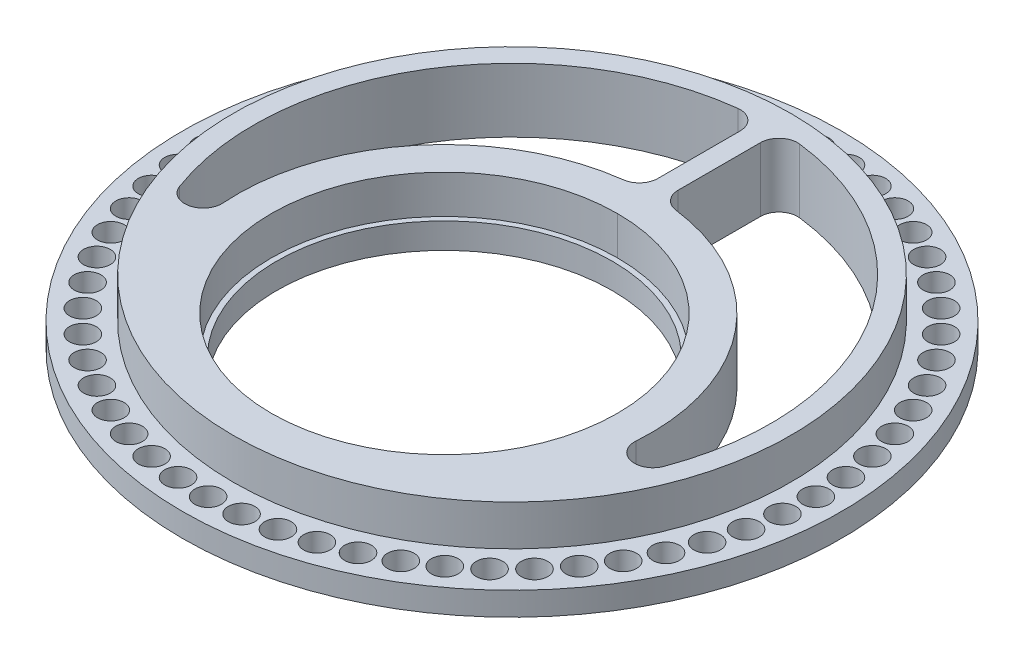
from build123d import *

# Parameters (mm, degrees)
SLOTTED_BODY_EXTRUDE_DEPTH      = 4.191
SLOTTED_BODY_EXTRUDE_DEPTH_BACK = 0.2032
SKETCH1_R                       = 64.4525
SKETCH1_R_2                     = 30.988
SKETCH5_R                       = 52.3875
BOSS_EXTRUDE3_DEPTH             = 7.62
SKETCH6_R                       = 32.512
CUT_EXTRUDE5_DEPTH              = 92.937971014
SKETCH8_R                       = 32.512
SKETCH8_R_2                     = 31.496
BOSS_EXTRUDE4_DEPTH             = 4.795000062
CUT_EXTRUDE6_DEPTH              = 92.937971014
MOVE_START                      = -0.2032
MOVE_FACE1_OUTLINE_R            = 64.4525
MOVE_FACE1_OUTLINE_R_2          = 61.9125
MOVE_FACE1_DEPTH                = 4.3942
SKETCH18_R                      = 2.5
CUT_EXTRUDE7_DEPTH              = 88.888450393
CIRPATTERN1_COUNT               = 60


# Read off the part's stored shape, not the designer's step: Move Face1
with BuildPart() as part:
    # Sketch1 → Slotted-Body Extrude (new, two sides: drawn at the far end of the back side and taken through both)
    with BuildSketch(Plane(origin=(0, 0, 0), x_dir=(1, 0, 0), z_dir=(0, 1, 0)).offset(-SLOTTED_BODY_EXTRUDE_DEPTH_BACK)):
        with Locations(Location((0, 0, 0), (0, 0, 270))):
            Circle(SKETCH1_R)
        with Locations(Location((0, -12.7, 0), (0, 0, 270))):
            Circle(SKETCH1_R_2, mode=Mode.SUBTRACT)
    extrude(amount=SLOTTED_BODY_EXTRUDE_DEPTH + SLOTTED_BODY_EXTRUDE_DEPTH_BACK)

    # Sketch5 → Boss-Extrude3 (add)
    with BuildSketch(Plane(origin=(0, 4.191, 0), x_dir=(1, 0, 0), z_dir=(0, 1, 0))):
        with Locations(Location((0, 0, 0), (0, 0, 90))):
            Circle(SKETCH5_R)
    extrude(amount=BOSS_EXTRUDE3_DEPTH)

    # Sketch6 → Cut-Extrude5 (cut, through all)
    with BuildSketch(Plane.XZ.offset(0.2032)):
        with Locations(Location((0, 12.7, 0), (0, 0, 270))):
            Circle(SKETCH6_R)
    extrude(amount=-CUT_EXTRUDE5_DEPTH, mode=Mode.SUBTRACT)

    # Sketch16 → Cut-Extrude6 (cut, through all)
    with BuildSketch(Plane(origin=(0, 11.811, 0), x_dir=(1, 0, 0), z_dir=(0, 1, 0))):
        with BuildLine():
            Line((1.905, 44.760744171), (1.905, 29.30917357))
            ThreePointArc((1.905, 29.30917357), (2.775290296, 27.00232019), (4.952428786, 25.845148763))
            ThreePointArc((4.952428786, 25.845148763), (30.083852846, 11.901155297), (38.761124089, -15.498267924))
            ThreePointArc((38.761124089, -15.498267924), (41.501270881, -19.162235056), (45.517024238, -16.969797016))
            ThreePointArc((45.517024238, -16.969797016), (41.490387768, 25.265019871), (5.815616197, 48.228125762))
            ThreePointArc((5.815616197, 48.228125762), (3.080466829, 47.37396317), (1.905, 44.760744171))
        make_face()
        with BuildLine():
            Line((-1.905, 44.760744171), (-1.905, 29.30917357))
            ThreePointArc((-1.905, 29.30917357), (-2.775290296, 27.00232019), (-4.952428786, 25.845148763))
            ThreePointArc((-4.952428786, 25.845148763), (-30.083852846, 11.901155297), (-38.761124089, -15.498267924))
            ThreePointArc((-38.761124089, -15.498267924), (-41.501270881, -19.162235056), (-45.517024238, -16.969797016))
            ThreePointArc((-45.517024238, -16.969797016), (-41.490387768, 25.265019871), (-5.815616197, 48.228125762))
            ThreePointArc((-5.815616197, 48.228125762), (-3.080466829, 47.37396317), (-1.905, 44.760744171))
        make_face()
    extrude(amount=-CUT_EXTRUDE6_DEPTH, mode=Mode.SUBTRACT)

    # Move Face1 outline → Move Face1 (cut)
    with BuildSketch(Plane(origin=(0, 0, 0), x_dir=(1, 0, 0), z_dir=(0, 1, 0)).offset(MOVE_START)):
        Circle(MOVE_FACE1_OUTLINE_R)
        Circle(MOVE_FACE1_OUTLINE_R_2, mode=Mode.SUBTRACT)
    extrude(amount=MOVE_FACE1_DEPTH, mode=Mode.SUBTRACT)

    # Sketch18 → Cut-Extrude7 (cut, through all)
    with BuildSketch(Plane(origin=(0, 4.191, 0), x_dir=(1, 0, 0), z_dir=(0, 1, 0))):
        with Locations(Location((0, 57.085947013, 0), (0, 0, 270))):
            Circle(SKETCH18_R)
    cut_extrude7 = extrude(amount=-CUT_EXTRUDE7_DEPTH, mode=Mode.SUBTRACT)

    # CirPattern1: Cut-Extrude7 ×60 about axis
    cirpattern1_axis = Axis((0, 0, 0), (0, 1, 0))
    for i in range(1, CIRPATTERN1_COUNT):
        add(cut_extrude7.rotate(cirpattern1_axis, i * 360 / CIRPATTERN1_COUNT), mode=Mode.SUBTRACT)


with BuildPart() as body_2:
    # Sketch8 → Boss-Extrude4 (new body)
    with BuildSketch(Plane.XZ.offset(0.2032)):
        with Locations(Location((0, 12.7, 0), (0, 0, 270))):
            Circle(SKETCH8_R)
        with Locations(Location((0, 12.7, 0), (0, 0, 270))):
            Circle(SKETCH8_R_2, mode=Mode.SUBTRACT)
    extrude(amount=-BOSS_EXTRUDE4_DEPTH)


solid = Compound([part.part, body_2.part])
